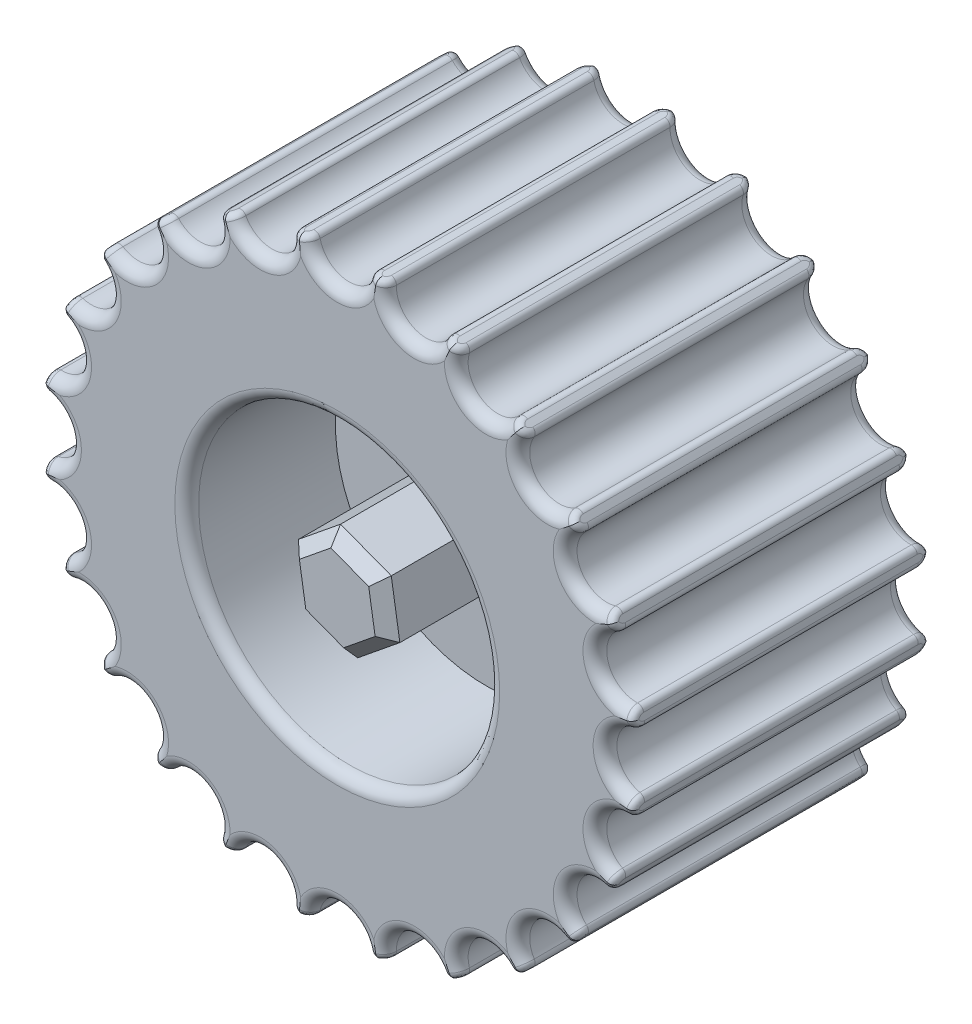
from build123d import *

# Parameters (mm, degrees)
SKETCH1_R           = 6.35
BOSS_EXTRUDE1_DEPTH = 6.35
SKETCH3_R           = 3.2131
CUT_EXTRUDE1_DEPTH  = 3.175
BOSS_EXTRUDE2_DEPTH = 3.175
SKETCH5_R           = 0.635
CUT_EXTRUDE2_DEPTH  = 11.998522628
FILLET1_R           = 0.254
CHAMFER1_SIZE       = 0.254
FILLET2_R           = 0.127


with BuildPart() as part:
    # Sketch1 → Boss-Extrude1 (new body)
    with BuildSketch(Plane.XY):
        Circle(SKETCH1_R)
    extrude(amount=BOSS_EXTRUDE1_DEPTH)

    # Sketch3 → Cut-Extrude1 (cut)
    with BuildSketch(Plane.XY.offset(6.35)):
        Circle(SKETCH3_R)
    extrude(amount=-CUT_EXTRUDE1_DEPTH, mode=Mode.SUBTRACT)

    # Sketch4 → Boss-Extrude2 (add)
    with BuildSketch(Plane.XY.offset(3.175)):
        Polygon((0.899085099, 0.730611962), (-0.18318597, 1.143936517), (-1.082271068, 0.413324555), (-0.899085099, -0.730611962), (0.18318597, -1.143936517), (1.082271068, -0.413324555), align=None)
    extrude(amount=BOSS_EXTRUDE2_DEPTH)

    # Sketch5 → Cut-Extrude2 (cut, through all)
    with BuildSketch(Plane(origin=(0, 0, 0), x_dir=(-1, 0, 0), z_dir=(0, 0, -1))):
        with Locations((0, 6.35)):
            Circle(SKETCH5_R)
        with Locations((1.643500936, 6.133628997)):
            Circle(SKETCH5_R)
        with Locations((3.175, 5.499261314)):
            Circle(SKETCH5_R)
        with Locations((4.490128061, 4.490128061)):
            Circle(SKETCH5_R)
        with Locations((5.499261314, 3.175)):
            Circle(SKETCH5_R)
        with Locations((6.133628997, 1.643500936)):
            Circle(SKETCH5_R)
        with Locations((6.35, 0)):
            Circle(SKETCH5_R)
        with Locations((6.133628997, -1.643500936)):
            Circle(SKETCH5_R)
        with Locations((5.499261314, -3.175)):
            Circle(SKETCH5_R)
        with Locations((4.490128061, -4.490128061)):
            Circle(SKETCH5_R)
        with Locations((3.175, -5.499261314)):
            Circle(SKETCH5_R)
        with Locations((1.643500936, -6.133628997)):
            Circle(SKETCH5_R)
        with Locations((0, -6.35)):
            Circle(SKETCH5_R)
        with Locations((-1.643500936, -6.133628997)):
            Circle(SKETCH5_R)
        with Locations((-3.175, -5.499261314)):
            Circle(SKETCH5_R)
        with Locations((-4.490128061, -4.490128061)):
            Circle(SKETCH5_R)
        with Locations((-5.499261314, -3.175)):
            Circle(SKETCH5_R)
        with Locations((-6.133628997, -1.643500936)):
            Circle(SKETCH5_R)
        with Locations((-6.35, 0)):
            Circle(SKETCH5_R)
        with Locations((-6.133628997, 1.643500936)):
            Circle(SKETCH5_R)
        with Locations((-5.499261314, 3.175)):
            Circle(SKETCH5_R)
        with Locations((-4.490128061, 4.490128061)):
            Circle(SKETCH5_R)
        with Locations((-3.175, 5.499261314)):
            Circle(SKETCH5_R)
        with Locations((-1.643500936, 6.133628997)):
            Circle(SKETCH5_R)
    extrude(amount=-CUT_EXTRUDE2_DEPTH, mode=Mode.SUBTRACT)

    # Fillet1
    # the kernel refuses this fillet: 0.254 mm, written as the material it takes off along each edge
    with BuildSketch(Plane(origin=(0, 0, 6.35), x_dir=(1, 0, 0), z_dir=(0, -1, 0))) as fillet1_piece_1:
        with BuildLine():
            CenterArc((3.2131 + FILLET1_R, -FILLET1_R), FILLET1_R, 90, 90)
            Line((3.2131, -FILLET1_R), (3.2131, 0))
            Line((3.2131, 0), (3.2131 + FILLET1_R, 0))
        make_face()
    revolve(axis=Axis((0, 0, 6.35), (0, 0, 1)), mode=Mode.SUBTRACT)
    with BuildSketch(Plane(origin=(3.175, 5.499261314, 6.35), x_dir=(0.9098442948493481, 0.41494982724432183, 0), z_dir=(-0.41494982724432183, 0.9098442948493481, 0))) as fillet1_piece_2:
        with BuildLine():
            CenterArc((0.635 + FILLET1_R, FILLET1_R), FILLET1_R, 180, 90)
            Line((0.635 + FILLET1_R, 0), (0.635, 0))
            Line((0.635, 0), (0.635, FILLET1_R))
        make_face()
    revolve(axis=Axis((3.175, 5.499261314, 6.35), (0, 0, -1)), revolution_arc=289.032313812, mode=Mode.SUBTRACT)
    with BuildSketch(Plane(origin=(4.490128061, 4.490128061, 6.35), x_dir=(0.9862390203495844, 0.1653257231645817, 0), z_dir=(-0.1653257231645817, 0.9862390203495844, 0))) as fillet1_piece_3:
        with BuildLine():
            CenterArc((0.635 + FILLET1_R, FILLET1_R), FILLET1_R, 180, 90)
            Line((0.635 + FILLET1_R, 0), (0.635, 0))
            Line((0.635, 0), (0.635, FILLET1_R))
        make_face()
    revolve(axis=Axis((4.490128061, 4.490128061, 6.35), (0, 0, -1)), revolution_arc=289.032313812, mode=Mode.SUBTRACT)
    with BuildSketch(Plane(origin=(5.499261314, 3.175, 6.35), x_dir=(0.9954231864500259, -0.09556505573522613, 0), z_dir=(0.09556505573522613, 0.9954231864500259, 0))) as fillet1_piece_4:
        with BuildLine():
            CenterArc((0.635 + FILLET1_R, FILLET1_R), FILLET1_R, 180, 90)
            Line((0.635 + FILLET1_R, 0), (0.635, 0))
            Line((0.635, 0), (0.635, FILLET1_R))
        make_face()
    revolve(axis=Axis((5.499261314, 3.175, 6.35), (0, 0, -1)), revolution_arc=289.032313812, mode=Mode.SUBTRACT)
    with BuildSketch(Plane(origin=(6.133628997, 1.643500936, 6.35), x_dir=(0.6362957863342693, 0.7714451842439964, 0), z_dir=(0.7714451842439964, -0.6362957863342693, 0))) as fillet1_piece_5:
        with BuildLine():
            CenterArc((0.635 + FILLET1_R, -FILLET1_R), FILLET1_R, 90, 90)
            Line((0.635, -FILLET1_R), (0.635, 0))
            Line((0.635, 0), (0.635 + FILLET1_R, 0))
        make_face()
    revolve(axis=Axis((6.133628997, 1.643500936, 6.35), (0, 0, 1)), revolution_arc=289.032313812, mode=Mode.SUBTRACT)
    with BuildSketch(Plane(origin=(6.35, 0, 6.35), x_dir=(0.8142792391139858, -0.5804733592060435, 0), z_dir=(0.5804733592060435, 0.8142792391139858, 0))) as fillet1_piece_6:
        with BuildLine():
            CenterArc((0.635 + FILLET1_R, FILLET1_R), FILLET1_R, 180, 90)
            Line((0.635 + FILLET1_R, 0), (0.635, 0))
            Line((0.635, 0), (0.635, FILLET1_R))
        make_face()
    revolve(axis=Axis((6.35, 0, 6.35), (0, 0, -1)), revolution_arc=289.032313812, mode=Mode.SUBTRACT)
    with BuildSketch(Plane(origin=(6.133628997, -1.643500936, 6.35), x_dir=(0.6362957863338796, -0.7714451842443183, 0), z_dir=(0.7714451842443183, 0.6362957863338796, 0))) as fillet1_piece_7:
        with BuildLine():
            CenterArc((0.635 + FILLET1_R, FILLET1_R), FILLET1_R, 180, 90)
            Line((0.635 + FILLET1_R, 0), (0.635, 0))
            Line((0.635, 0), (0.635, FILLET1_R))
        make_face()
    revolve(axis=Axis((6.133628997, -1.643500936, 6.35), (0, 0, -1)), revolution_arc=289.032313812, mode=Mode.SUBTRACT)
    with BuildSketch(Plane(origin=(5.499261314, -3.175, 6.35), x_dir=(0.4149498272435432, -0.9098442948497033, 0), z_dir=(0.9098442948497033, 0.4149498272435432, 0))) as fillet1_piece_8:
        with BuildLine():
            CenterArc((0.635 + FILLET1_R, FILLET1_R), FILLET1_R, 180, 90)
            Line((0.635 + FILLET1_R, 0), (0.635, 0))
            Line((0.635, 0), (0.635, FILLET1_R))
        make_face()
    revolve(axis=Axis((5.499261314, -3.175, 6.35), (0, 0, -1)), revolution_arc=289.032313812, mode=Mode.SUBTRACT)
    with BuildSketch(Plane(origin=(4.490128061, -4.490128061, 6.35), x_dir=(0.16532572316351857, -0.9862390203497627, 0), z_dir=(0.9862390203497627, 0.16532572316351857, 0))) as fillet1_piece_9:
        with BuildLine():
            CenterArc((0.635 + FILLET1_R, FILLET1_R), FILLET1_R, 180, 90)
            Line((0.635 + FILLET1_R, 0), (0.635, 0))
            Line((0.635, 0), (0.635, FILLET1_R))
        make_face()
    revolve(axis=Axis((4.490128061, -4.490128061, 6.35), (0, 0, -1)), revolution_arc=289.032313812, mode=Mode.SUBTRACT)
    with BuildSketch(Plane(origin=(3.175, -5.499261314, 6.35), x_dir=(-0.09556505573642783, -0.9954231864499106, 0), z_dir=(0.9954231864499106, -0.09556505573642783, 0))) as fillet1_piece_10:
        with BuildLine():
            CenterArc((0.635 + FILLET1_R, FILLET1_R), FILLET1_R, 180, 90)
            Line((0.635 + FILLET1_R, 0), (0.635, 0))
            Line((0.635, 0), (0.635, FILLET1_R))
        make_face()
    revolve(axis=Axis((3.175, -5.499261314, 6.35), (0, 0, -1)), revolution_arc=289.032313812, mode=Mode.SUBTRACT)
    with BuildSketch(Plane(origin=(1.643500936, -6.133628997, 6.35), x_dir=(-0.34994323401662314, -0.936770907407989, 0), z_dir=(0.936770907407989, -0.34994323401662314, 0))) as fillet1_piece_11:
        with BuildLine():
            CenterArc((0.635 + FILLET1_R, FILLET1_R), FILLET1_R, 180, 90)
            Line((0.635 + FILLET1_R, 0), (0.635, 0))
            Line((0.635, 0), (0.635, FILLET1_R))
        make_face()
    revolve(axis=Axis((1.643500936, -6.133628997, 6.35), (0, 0, -1)), revolution_arc=289.032313812, mode=Mode.SUBTRACT)
    with BuildSketch(Plane(origin=(0, -6.35, 6.35), x_dir=(-0.5804733592070518, -0.8142792391132669, 0), z_dir=(0.8142792391132669, -0.5804733592070518, 0))) as fillet1_piece_12:
        with BuildLine():
            CenterArc((0.635 + FILLET1_R, FILLET1_R), FILLET1_R, 180, 90)
            Line((0.635 + FILLET1_R, 0), (0.635, 0))
            Line((0.635, 0), (0.635, FILLET1_R))
        make_face()
    revolve(axis=Axis((0, -6.35, 6.35), (0, 0, -1)), revolution_arc=289.032313812, mode=Mode.SUBTRACT)
    with BuildSketch(Plane(origin=(-1.643500936, -6.133628997, 6.35), x_dir=(-0.7714451842450257, -0.6362957863330218, 0), z_dir=(0.6362957863330218, -0.7714451842450257, 0))) as fillet1_piece_13:
        with BuildLine():
            CenterArc((0.635 + FILLET1_R, FILLET1_R), FILLET1_R, 180, 90)
            Line((0.635 + FILLET1_R, 0), (0.635, 0))
            Line((0.635, 0), (0.635, FILLET1_R))
        make_face()
    revolve(axis=Axis((-1.643500936, -6.133628997, 6.35), (0, 0, -1)), revolution_arc=289.032313812, mode=Mode.SUBTRACT)
    with BuildSketch(Plane(origin=(-3.175, -5.499261314, 6.35), x_dir=(-0.909844294850085, -0.41494982724270635, 0), z_dir=(0.41494982724270635, -0.909844294850085, 0))) as fillet1_piece_14:
        with BuildLine():
            CenterArc((0.635 + FILLET1_R, FILLET1_R), FILLET1_R, 180, 90)
            Line((0.635 + FILLET1_R, 0), (0.635, 0))
            Line((0.635, 0), (0.635, FILLET1_R))
        make_face()
    revolve(axis=Axis((-3.175, -5.499261314, 6.35), (0, 0, -1)), revolution_arc=289.032313812, mode=Mode.SUBTRACT)
    with BuildSketch(Plane(origin=(-4.490128061, -4.490128061, 6.35), x_dir=(-0.9862390203498705, -0.16532572316287528, 0), z_dir=(0.16532572316287528, -0.9862390203498705, 0))) as fillet1_piece_15:
        with BuildLine():
            CenterArc((0.635 + FILLET1_R, FILLET1_R), FILLET1_R, 180, 90)
            Line((0.635 + FILLET1_R, 0), (0.635, 0))
            Line((0.635, 0), (0.635, FILLET1_R))
        make_face()
    revolve(axis=Axis((-4.490128061, -4.490128061, 6.35), (0, 0, -1)), revolution_arc=289.032313812, mode=Mode.SUBTRACT)
    with BuildSketch(Plane(origin=(-5.499261314, -3.175, 6.35), x_dir=(-0.9954231864498778, 0.09556505573677002, 0), z_dir=(-0.09556505573677002, -0.9954231864498778, 0))) as fillet1_piece_16:
        with BuildLine():
            CenterArc((0.635 + FILLET1_R, FILLET1_R), FILLET1_R, 180, 90)
            Line((0.635 + FILLET1_R, 0), (0.635, 0))
            Line((0.635, 0), (0.635, FILLET1_R))
        make_face()
    revolve(axis=Axis((-5.499261314, -3.175, 6.35), (0, 0, -1)), revolution_arc=289.032313812, mode=Mode.SUBTRACT)
    with BuildSketch(Plane(origin=(-6.133628997, -1.643500936, 6.35), x_dir=(-0.9367709074079861, 0.3499432340166307, 0), z_dir=(-0.3499432340166307, -0.9367709074079861, 0))) as fillet1_piece_17:
        with BuildLine():
            CenterArc((0.635 + FILLET1_R, FILLET1_R), FILLET1_R, 180, 90)
            Line((0.635 + FILLET1_R, 0), (0.635, 0))
            Line((0.635, 0), (0.635, FILLET1_R))
        make_face()
    revolve(axis=Axis((-6.133628997, -1.643500936, 6.35), (0, 0, -1)), revolution_arc=289.032313812, mode=Mode.SUBTRACT)
    with BuildSketch(Plane(origin=(-6.35, 0, 6.35), x_dir=(-0.8142792391134588, 0.5804733592067826, 0), z_dir=(-0.5804733592067826, -0.8142792391134588, 0))) as fillet1_piece_18:
        with BuildLine():
            CenterArc((0.635 + FILLET1_R, FILLET1_R), FILLET1_R, 180, 90)
            Line((0.635 + FILLET1_R, 0), (0.635, 0))
            Line((0.635, 0), (0.635, FILLET1_R))
        make_face()
    revolve(axis=Axis((-6.35, 0, 6.35), (0, 0, -1)), revolution_arc=289.032313812, mode=Mode.SUBTRACT)
    with BuildSketch(Plane(origin=(-6.133628997, 1.643500936, 6.35), x_dir=(-0.6362957863335225, 0.7714451842446127, 0), z_dir=(-0.7714451842446127, -0.6362957863335225, 0))) as fillet1_piece_19:
        with BuildLine():
            CenterArc((0.635 + FILLET1_R, FILLET1_R), FILLET1_R, 180, 90)
            Line((0.635 + FILLET1_R, 0), (0.635, 0))
            Line((0.635, 0), (0.635, FILLET1_R))
        make_face()
    revolve(axis=Axis((-6.133628997, 1.643500936, 6.35), (0, 0, -1)), revolution_arc=289.032313812, mode=Mode.SUBTRACT)
    with BuildSketch(Plane(origin=(-5.499261314, 3.175, 6.35), x_dir=(-0.4149498272435533, 0.9098442948496986, 0), z_dir=(-0.9098442948496986, -0.4149498272435533, 0))) as fillet1_piece_20:
        with BuildLine():
            CenterArc((0.635 + FILLET1_R, FILLET1_R), FILLET1_R, 180, 90)
            Line((0.635 + FILLET1_R, 0), (0.635, 0))
            Line((0.635, 0), (0.635, FILLET1_R))
        make_face()
    revolve(axis=Axis((-5.499261314, 3.175, 6.35), (0, 0, -1)), revolution_arc=289.032313812, mode=Mode.SUBTRACT)
    with BuildSketch(Plane(origin=(-4.490128061, 4.490128061, 6.35), x_dir=(-0.1653257231640058, 0.986239020349681, 0), z_dir=(-0.986239020349681, -0.1653257231640058, 0))) as fillet1_piece_21:
        with BuildLine():
            CenterArc((0.635 + FILLET1_R, FILLET1_R), FILLET1_R, 180, 90)
            Line((0.635 + FILLET1_R, 0), (0.635, 0))
            Line((0.635, 0), (0.635, FILLET1_R))
        make_face()
    revolve(axis=Axis((-4.490128061, 4.490128061, 6.35), (0, 0, -1)), revolution_arc=289.032313812, mode=Mode.SUBTRACT)
    with BuildSketch(Plane(origin=(-3.175, 5.499261314, 6.35), x_dir=(0.09556505573548738, 0.9954231864500008, 0), z_dir=(-0.9954231864500008, 0.09556505573548738, 0))) as fillet1_piece_22:
        with BuildLine():
            CenterArc((0.635 + FILLET1_R, FILLET1_R), FILLET1_R, 180, 90)
            Line((0.635 + FILLET1_R, 0), (0.635, 0))
            Line((0.635, 0), (0.635, FILLET1_R))
        make_face()
    revolve(axis=Axis((-3.175, 5.499261314, 6.35), (0, 0, -1)), revolution_arc=289.032313812, mode=Mode.SUBTRACT)
    with BuildSketch(Plane(origin=(-1.643500936, 6.133628997, 6.35), x_dir=(0.34994323401522254, 0.9367709074085122, 0), z_dir=(-0.9367709074085122, 0.34994323401522254, 0))) as fillet1_piece_23:
        with BuildLine():
            CenterArc((0.635 + FILLET1_R, FILLET1_R), FILLET1_R, 180, 90)
            Line((0.635 + FILLET1_R, 0), (0.635, 0))
            Line((0.635, 0), (0.635, FILLET1_R))
        make_face()
    revolve(axis=Axis((-1.643500936, 6.133628997, 6.35), (0, 0, -1)), revolution_arc=289.032313812, mode=Mode.SUBTRACT)
    with BuildSketch(Plane(origin=(0, 6.35, 6.35), x_dir=(0.5804733592057173, 0.8142792391142183, 0), z_dir=(-0.8142792391142183, 0.5804733592057173, 0))) as fillet1_piece_24:
        with BuildLine():
            CenterArc((0.635 + FILLET1_R, FILLET1_R), FILLET1_R, 180, 90)
            Line((0.635 + FILLET1_R, 0), (0.635, 0))
            Line((0.635, 0), (0.635, FILLET1_R))
        make_face()
    revolve(axis=Axis((0, 6.35, 6.35), (0, 0, -1)), revolution_arc=289.032313812, mode=Mode.SUBTRACT)
    with BuildSketch(Plane(origin=(1.643500936, 6.133628997, 6.35), x_dir=(0.7714451842439507, 0.636295786334325, 0), z_dir=(-0.636295786334325, 0.7714451842439507, 0))) as fillet1_piece_25:
        with BuildLine():
            CenterArc((0.635 + FILLET1_R, FILLET1_R), FILLET1_R, 180, 90)
            Line((0.635 + FILLET1_R, 0), (0.635, 0))
            Line((0.635, 0), (0.635, FILLET1_R))
        make_face()
    revolve(axis=Axis((1.643500936, 6.133628997, 6.35), (0, 0, -1)), revolution_arc=289.032313812, mode=Mode.SUBTRACT)
    with BuildSketch(Plane(origin=(0, 6.35, 0), x_dir=(0.5804733592057083, 0.8142792391142248, 0), z_dir=(-0.8142792391142248, 0.5804733592057083, 0))) as fillet1_piece_26:
        with BuildLine():
            CenterArc((0.635 + FILLET1_R, -FILLET1_R), FILLET1_R, 90, 90)
            Line((0.635 + FILLET1_R, 0), (0.635, 0))
            Line((0.635, 0), (0.635, -FILLET1_R))
        make_face()
    revolve(axis=Axis((0, 6.35, 0), (0, 0, -1)), revolution_arc=289.032313812, mode=Mode.SUBTRACT)
    with BuildSketch(Plane(origin=(-1.643500936, 6.133628997, 0), x_dir=(0.3499432340151975, 0.9367709074085214, 0), z_dir=(-0.9367709074085214, 0.3499432340151975, 0))) as fillet1_piece_27:
        with BuildLine():
            CenterArc((0.635 + FILLET1_R, -FILLET1_R), FILLET1_R, 90, 90)
            Line((0.635 + FILLET1_R, 0), (0.635, 0))
            Line((0.635, 0), (0.635, -FILLET1_R))
        make_face()
    revolve(axis=Axis((-1.643500936, 6.133628997, 0), (0, 0, -1)), revolution_arc=289.032313812, mode=Mode.SUBTRACT)
    with BuildSketch(Plane(origin=(-3.175, 5.499261314, 0), x_dir=(0.0955650557355119, 0.9954231864499986, 0), z_dir=(-0.9954231864499986, 0.0955650557355119, 0))) as fillet1_piece_28:
        with BuildLine():
            CenterArc((0.635 + FILLET1_R, -FILLET1_R), FILLET1_R, 90, 90)
            Line((0.635 + FILLET1_R, 0), (0.635, 0))
            Line((0.635, 0), (0.635, -FILLET1_R))
        make_face()
    revolve(axis=Axis((-3.175, 5.499261314, 0), (0, 0, -1)), revolution_arc=289.032313812, mode=Mode.SUBTRACT)
    with BuildSketch(Plane(origin=(-4.490128061, 4.490128061, 0), x_dir=(-0.16532572316400443, 0.9862390203496813, 0), z_dir=(-0.9862390203496813, -0.16532572316400443, 0))) as fillet1_piece_29:
        with BuildLine():
            CenterArc((0.635 + FILLET1_R, -FILLET1_R), FILLET1_R, 90, 90)
            Line((0.635 + FILLET1_R, 0), (0.635, 0))
            Line((0.635, 0), (0.635, -FILLET1_R))
        make_face()
    revolve(axis=Axis((-4.490128061, 4.490128061, 0), (0, 0, -1)), revolution_arc=289.032313812, mode=Mode.SUBTRACT)
    with BuildSketch(Plane(origin=(-5.499261314, 3.175, 0), x_dir=(-0.41494982724352936, 0.9098442948497095, 0), z_dir=(-0.9098442948497095, -0.41494982724352936, 0))) as fillet1_piece_30:
        with BuildLine():
            CenterArc((0.635 + FILLET1_R, -FILLET1_R), FILLET1_R, 90, 90)
            Line((0.635 + FILLET1_R, 0), (0.635, 0))
            Line((0.635, 0), (0.635, -FILLET1_R))
        make_face()
    revolve(axis=Axis((-5.499261314, 3.175, 0), (0, 0, -1)), revolution_arc=289.032313812, mode=Mode.SUBTRACT)
    with BuildSketch(Plane(origin=(-6.133628997, 1.643500936, 0), x_dir=(-0.6362957863335128, 0.7714451842446205, 0), z_dir=(-0.7714451842446205, -0.6362957863335128, 0))) as fillet1_piece_31:
        with BuildLine():
            CenterArc((0.635 + FILLET1_R, -FILLET1_R), FILLET1_R, 90, 90)
            Line((0.635 + FILLET1_R, 0), (0.635, 0))
            Line((0.635, 0), (0.635, -FILLET1_R))
        make_face()
    revolve(axis=Axis((-6.133628997, 1.643500936, 0), (0, 0, -1)), revolution_arc=289.032313812, mode=Mode.SUBTRACT)
    with BuildSketch(Plane(origin=(-6.35, 0, 0), x_dir=(-0.8142792391134647, 0.5804733592067743, 0), z_dir=(-0.5804733592067743, -0.8142792391134647, 0))) as fillet1_piece_32:
        with BuildLine():
            CenterArc((0.635 + FILLET1_R, -FILLET1_R), FILLET1_R, 90, 90)
            Line((0.635 + FILLET1_R, 0), (0.635, 0))
            Line((0.635, 0), (0.635, -FILLET1_R))
        make_face()
    revolve(axis=Axis((-6.35, 0, 0), (0, 0, -1)), revolution_arc=289.032313812, mode=Mode.SUBTRACT)
    with BuildSketch(Plane(origin=(-6.133628997, -1.643500936, 0), x_dir=(-0.9367709074079825, 0.34994323401664, 0), z_dir=(-0.34994323401664, -0.9367709074079825, 0))) as fillet1_piece_33:
        with BuildLine():
            CenterArc((0.635 + FILLET1_R, -FILLET1_R), FILLET1_R, 90, 90)
            Line((0.635 + FILLET1_R, 0), (0.635, 0))
            Line((0.635, 0), (0.635, -FILLET1_R))
        make_face()
    revolve(axis=Axis((-6.133628997, -1.643500936, 0), (0, 0, -1)), revolution_arc=289.032313812, mode=Mode.SUBTRACT)
    with BuildSketch(Plane(origin=(-5.499261314, -3.175, 0), x_dir=(-0.9954231864498754, 0.09556505573679523, 0), z_dir=(-0.09556505573679523, -0.9954231864498754, 0))) as fillet1_piece_34:
        with BuildLine():
            CenterArc((0.635 + FILLET1_R, -FILLET1_R), FILLET1_R, 90, 90)
            Line((0.635 + FILLET1_R, 0), (0.635, 0))
            Line((0.635, 0), (0.635, -FILLET1_R))
        make_face()
    revolve(axis=Axis((-5.499261314, -3.175, 0), (0, 0, -1)), revolution_arc=289.032313812, mode=Mode.SUBTRACT)
    with BuildSketch(Plane(origin=(-4.490128061, -4.490128061, 0), x_dir=(-0.9862390203498705, -0.16532572316287528, 0), z_dir=(0.16532572316287528, -0.9862390203498705, 0))) as fillet1_piece_35:
        with BuildLine():
            CenterArc((0.635 + FILLET1_R, -FILLET1_R), FILLET1_R, 90, 90)
            Line((0.635 + FILLET1_R, 0), (0.635, 0))
            Line((0.635, 0), (0.635, -FILLET1_R))
        make_face()
    revolve(axis=Axis((-4.490128061, -4.490128061, 0), (0, 0, -1)), revolution_arc=289.032313812, mode=Mode.SUBTRACT)
    with BuildSketch(Plane(origin=(-3.175, -5.499261314, 0), x_dir=(-0.9098442948500944, -0.4149498272426852, 0), z_dir=(0.4149498272426852, -0.9098442948500944, 0))) as fillet1_piece_36:
        with BuildLine():
            CenterArc((0.635 + FILLET1_R, -FILLET1_R), FILLET1_R, 90, 90)
            Line((0.635 + FILLET1_R, 0), (0.635, 0))
            Line((0.635, 0), (0.635, -FILLET1_R))
        make_face()
    revolve(axis=Axis((-3.175, -5.499261314, 0), (0, 0, -1)), revolution_arc=289.032313812, mode=Mode.SUBTRACT)
    with BuildSketch(Plane(origin=(-1.643500936, -6.133628997, 0), x_dir=(-0.7714451842450145, -0.6362957863330352, 0), z_dir=(0.6362957863330352, -0.7714451842450145, 0))) as fillet1_piece_37:
        with BuildLine():
            CenterArc((0.635 + FILLET1_R, -FILLET1_R), FILLET1_R, 90, 90)
            Line((0.635 + FILLET1_R, 0), (0.635, 0))
            Line((0.635, 0), (0.635, -FILLET1_R))
        make_face()
    revolve(axis=Axis((-1.643500936, -6.133628997, 0), (0, 0, -1)), revolution_arc=289.032313812, mode=Mode.SUBTRACT)
    with BuildSketch(Plane(origin=(0, -6.35, 0), x_dir=(-0.5804733592070435, -0.8142792391132728, 0), z_dir=(0.8142792391132728, -0.5804733592070435, 0))) as fillet1_piece_38:
        with BuildLine():
            CenterArc((0.635 + FILLET1_R, -FILLET1_R), FILLET1_R, 90, 90)
            Line((0.635 + FILLET1_R, 0), (0.635, 0))
            Line((0.635, 0), (0.635, -FILLET1_R))
        make_face()
    revolve(axis=Axis((0, -6.35, 0), (0, 0, -1)), revolution_arc=289.032313812, mode=Mode.SUBTRACT)
    with BuildSketch(Plane(origin=(1.643500936, -6.133628997, 0), x_dir=(0.7714451842446837, -0.6362957863334364, 0), z_dir=(-0.6362957863334364, -0.7714451842446837, 0))) as fillet1_piece_39:
        with BuildLine():
            CenterArc((0.635 + FILLET1_R, FILLET1_R), FILLET1_R, 180, 90)
            Line((0.635 + FILLET1_R, 0), (0.635, 0))
            Line((0.635, 0), (0.635, FILLET1_R))
        make_face()
    revolve(axis=Axis((1.643500936, -6.133628997, 0), (0, 0, 1)), revolution_arc=289.032313812, mode=Mode.SUBTRACT)
    with BuildSketch(Plane(origin=(3.175, -5.499261314, 0), x_dir=(0.9098442948497907, -0.4149498272433513, 0), z_dir=(-0.4149498272433513, -0.9098442948497907, 0))) as fillet1_piece_40:
        with BuildLine():
            CenterArc((0.635 + FILLET1_R, FILLET1_R), FILLET1_R, 180, 90)
            Line((0.635 + FILLET1_R, 0), (0.635, 0))
            Line((0.635, 0), (0.635, FILLET1_R))
        make_face()
    revolve(axis=Axis((3.175, -5.499261314, 0), (0, 0, 1)), revolution_arc=289.032313812, mode=Mode.SUBTRACT)
    with BuildSketch(Plane(origin=(4.490128061, -4.490128061, 0), x_dir=(0.9862390203497224, -0.16532572316375782, 0), z_dir=(-0.16532572316375782, -0.9862390203497224, 0))) as fillet1_piece_41:
        with BuildLine():
            CenterArc((0.635 + FILLET1_R, FILLET1_R), FILLET1_R, 180, 90)
            Line((0.635 + FILLET1_R, 0), (0.635, 0))
            Line((0.635, 0), (0.635, FILLET1_R))
        make_face()
    revolve(axis=Axis((4.490128061, -4.490128061, 0), (0, 0, 1)), revolution_arc=289.032313812, mode=Mode.SUBTRACT)
    with BuildSketch(Plane(origin=(5.499261314, -3.175, 0), x_dir=(0.9954231864499721, 0.09556505573578714, 0), z_dir=(0.09556505573578714, -0.9954231864499721, 0))) as fillet1_piece_42:
        with BuildLine():
            CenterArc((0.635 + FILLET1_R, FILLET1_R), FILLET1_R, 180, 90)
            Line((0.635 + FILLET1_R, 0), (0.635, 0))
            Line((0.635, 0), (0.635, FILLET1_R))
        make_face()
    revolve(axis=Axis((5.499261314, -3.175, 0), (0, 0, 1)), revolution_arc=289.032313812, mode=Mode.SUBTRACT)
    with BuildSketch(Plane(origin=(6.133628997, -1.643500936, 0), x_dir=(0.9367709074083662, 0.34994323401561306, 0), z_dir=(0.34994323401561306, -0.9367709074083662, 0))) as fillet1_piece_43:
        with BuildLine():
            CenterArc((0.635 + FILLET1_R, FILLET1_R), FILLET1_R, 180, 90)
            Line((0.635 + FILLET1_R, 0), (0.635, 0))
            Line((0.635, 0), (0.635, FILLET1_R))
        make_face()
    revolve(axis=Axis((6.133628997, -1.643500936, 0), (0, 0, 1)), revolution_arc=289.032313812, mode=Mode.SUBTRACT)
    with BuildSketch(Plane(origin=(6.35, 0, 0), x_dir=(0.8142792391140643, 0.5804733592059335, 0), z_dir=(0.5804733592059335, -0.8142792391140643, 0))) as fillet1_piece_44:
        with BuildLine():
            CenterArc((0.635 + FILLET1_R, FILLET1_R), FILLET1_R, 180, 90)
            Line((0.635 + FILLET1_R, 0), (0.635, 0))
            Line((0.635, 0), (0.635, FILLET1_R))
        make_face()
    revolve(axis=Axis((6.35, 0, 0), (0, 0, 1)), revolution_arc=289.032313812, mode=Mode.SUBTRACT)
    with BuildSketch(Plane(origin=(6.133628997, 1.643500936, 0), x_dir=(0.6362957863342817, 0.7714451842439864, 0), z_dir=(0.7714451842439864, -0.6362957863342817, 0))) as fillet1_piece_45:
        with BuildLine():
            CenterArc((0.635 + FILLET1_R, FILLET1_R), FILLET1_R, 180, 90)
            Line((0.635 + FILLET1_R, 0), (0.635, 0))
            Line((0.635, 0), (0.635, FILLET1_R))
        make_face()
    revolve(axis=Axis((6.133628997, 1.643500936, 0), (0, 0, 1)), revolution_arc=289.032313812, mode=Mode.SUBTRACT)
    with BuildSketch(Plane(origin=(5.499261314, 3.175, 0), x_dir=(0.4149498272442729, 0.9098442948493703, 0), z_dir=(0.9098442948493703, -0.4149498272442729, 0))) as fillet1_piece_46:
        with BuildLine():
            CenterArc((0.635 + FILLET1_R, FILLET1_R), FILLET1_R, 180, 90)
            Line((0.635 + FILLET1_R, 0), (0.635, 0))
            Line((0.635, 0), (0.635, FILLET1_R))
        make_face()
    revolve(axis=Axis((5.499261314, 3.175, 0), (0, 0, 1)), revolution_arc=289.032313812, mode=Mode.SUBTRACT)
    with BuildSketch(Plane(origin=(4.490128061, 4.490128061, 0), x_dir=(0.16532572316462227, 0.9862390203495777, 0), z_dir=(0.9862390203495777, -0.16532572316462227, 0))) as fillet1_piece_47:
        with BuildLine():
            CenterArc((0.635 + FILLET1_R, FILLET1_R), FILLET1_R, 180, 90)
            Line((0.635 + FILLET1_R, 0), (0.635, 0))
            Line((0.635, 0), (0.635, FILLET1_R))
        make_face()
    revolve(axis=Axis((4.490128061, 4.490128061, 0), (0, 0, 1)), revolution_arc=289.032313812, mode=Mode.SUBTRACT)
    with BuildSketch(Plane(origin=(3.175, 5.499261314, 0), x_dir=(-0.0955650557351304, 0.9954231864500351, 0), z_dir=(0.9954231864500351, 0.0955650557351304, 0))) as fillet1_piece_48:
        with BuildLine():
            CenterArc((0.635 + FILLET1_R, FILLET1_R), FILLET1_R, 180, 90)
            Line((0.635 + FILLET1_R, 0), (0.635, 0))
            Line((0.635, 0), (0.635, FILLET1_R))
        make_face()
    revolve(axis=Axis((3.175, 5.499261314, 0), (0, 0, 1)), revolution_arc=289.032313812, mode=Mode.SUBTRACT)
    with BuildSketch(Plane(origin=(1.643500936, 6.133628997, 0), x_dir=(-0.3499432340152349, 0.9367709074085075, 0), z_dir=(0.9367709074085075, 0.3499432340152349, 0))) as fillet1_piece_49:
        with BuildLine():
            CenterArc((0.635 + FILLET1_R, FILLET1_R), FILLET1_R, 180, 90)
            Line((0.635 + FILLET1_R, 0), (0.635, 0))
            Line((0.635, 0), (0.635, FILLET1_R))
        make_face()
    revolve(axis=Axis((1.643500936, 6.133628997, 0), (0, 0, 1)), revolution_arc=289.032313812, mode=Mode.SUBTRACT)

    # Chamfer1
    chamfer1_edges = [part.edges().sort_by_distance(p)[0] for p in [
        (0.990678084, 0.158643703, 6.35),
        (0.357949565, 0.937274239, 6.35),
        (-0.632728519, 0.778630536, 6.35),
        (-0.990678084, -0.158643703, 6.35),
        (-0.357949565, -0.937274239, 6.35),
        (0.632728519, -0.778630536, 6.35),
    ]]
    chamfer(chamfer1_edges, length=CHAMFER1_SIZE)

    # Fillet2
    fillet2_edges = [part.edges().sort_by_distance(p)[0] for p in [
        (-5.919140926, 2.299189121, 0.096308676),
        (-5.81123677, 2.559692778, 0.096309101),
        (-5.788867884, 2.609886706, 3.175),
        (-5.154662131, 3.708363294, 3.175),
        (-5.811236764, 2.559692793, 6.253690879),
        (-5.91914092, 2.299189136, 6.253691344),
        (-6.267105379, 1.022687715, 3.175),
        (-5.938816324, 2.247879148, 3.175),
        (-5.122377172, 3.752832533, 0.096308708),
        (-4.950726439, 3.976532113, 0.096309101),
        (-4.916128609, 4.019226231, 3.175),
        (-4.019226231, 4.916128609, 3.175),
        (-4.950726429, 3.976532126, 6.253690879),
        (-5.122377163, 3.752832546, 6.253691312),
        (-3.976531852, 4.950726649, 0.096308678),
        (-3.752832282, 5.122377357, 0.096309101),
        (-3.708363294, 5.154662131, 3.175),
        (-2.609886706, 5.788867884, 3.175),
        (-3.752832269, 5.122377366, 6.253690879),
        (-3.976531839, 4.950726659, 6.253691343),
        (-2.559692793, 5.811236764, 0.096309122),
        (-2.299188807, 5.919141048, 0.096309101),
        (-2.247879148, 5.938816324, 3.175),
        (-1.022687715, 6.267105379, 3.175),
        (-2.299188791, 5.919141054, 6.253690879),
        (-2.559692778, 5.81123677, 6.253690899),
        (-0.968414626, 6.275720917, 0.096309122),
        (-0.688859414, 6.312525059, 0.096309101),
        (-0.634205753, 6.31825, 3.175),
        (0.634205753, 6.31825, 3.175),
        (-0.688859398, 6.312525061, 6.253690879),
        (-0.96841461, 6.27572092, 6.253690899),
        (0.688859414, 6.312525059, 0.096309101),
        (0.968414626, 6.275720917, 0.096309121),
        (1.022687715, 6.267105379, 3.175),
        (2.247879148, 5.938816324, 3.175),
        (0.968414626, 6.275720917, 6.253690879),
        (0.688859414, 6.31252506, 6.253690899),
        (2.299188791, 5.919141054, 0.096309121),
        (2.559692478, 5.811236903, 0.096308688),
        (2.609886706, 5.788867884, 3.175),
        (3.708363294, 5.154662131, 3.175),
        (2.559692477, 5.811236903, 6.253691313),
        (2.299188791, 5.919141054, 6.253690879),
        (3.752832549, 5.12237716, 0.096308682),
        (3.976531849, 4.950726651, 0.096308674),
        (4.019226231, 4.916128609, 3.175),
        (4.916128609, 4.019226231, 3.175),
        (3.976531862, 4.95072664, 6.253691305),
        (3.752832563, 5.122377151, 6.253691338),
        (4.950726643, 3.976531859, 0.09630869),
        (5.122377157, 3.752832554, 0.096308675),
        (5.154662131, 3.708363294, 3.175),
        (5.788867884, 2.609886706, 3.175),
        (5.122377159, 3.752832551, 6.25369132),
        (4.950726653, 3.976531846, 6.253691331),
        (5.811236907, 2.559692468, 0.096308674),
        (5.919141048, 2.299188807, 0.096309101),
        (5.938816324, 2.247879148, 3.175),
        (6.267105379, 1.022687715, 3.175),
        (5.919141054, 2.299188791, 6.253690878),
        (5.811236913, 2.559692453, 6.253691346),
        (6.275720917, 0.968414626, 0.096309121),
        (6.31252506, 0.688859414, 0.096309101),
        (6.31825, 0.634205753, 3.175),
        (6.31825, -0.634205753, 3.175),
        (6.312525061, 0.688859398, 6.253690879),
        (6.27572092, 0.96841461, 6.253690899),
        (6.312525023, -0.688859749, 0.096308676),
        (6.27572092, -0.96841461, 0.096309101),
        (6.267105379, -1.022687715, 3.175),
        (5.938816324, -2.247879148, 3.175),
        (6.275720917, -0.968414626, 6.253690879),
        (6.312525021, -0.688859765, 6.253691344),
        (5.919141054, -2.299188791, 0.096309121),
        (5.81123677, -2.559692778, 0.096309101),
        (5.788867884, -2.609886706, 3.175),
        (5.154662131, -3.708363294, 3.175),
        (5.811236764, -2.559692793, 6.253690879),
        (5.91914091, -2.299189163, 6.253691381),
        (5.122377165, -3.752832544, 0.096308691),
        (4.950726439, -3.976532113, 0.096309101),
        (4.916128609, -4.019226231, 3.175),
        (4.019226231, -4.916128609, 3.175),
        (4.950726429, -3.976532126, 6.253690879),
        (5.122377155, -3.752832557, 6.253691329),
        (3.976532126, -4.950726429, 0.096309121),
        (3.752832282, -5.122377357, 0.096309101),
        (3.708363294, -5.154662131, 3.175),
        (2.609886706, -5.788867884, 3.175),
        (3.752832269, -5.122377366, 6.253690879),
        (3.976532113, -4.950726439, 6.253690899),
        (2.559692793, -5.811236764, 0.096309121),
        (2.299188807, -5.919141048, 0.096309101),
        (2.247879148, -5.938816324, 3.175),
        (1.022687715, -6.267105379, 3.175),
        (2.299188791, -5.919141054, 6.253690879),
        (2.559692778, -5.81123677, 6.253690899),
        (0.968414626, -6.275720917, 0.096309121),
        (0.688859414, -6.312525059, 0.096309101),
        (0.634205753, -6.31825, 3.175),
        (-0.634205753, -6.31825, 3.175),
        (0.688859398, -6.312525061, 6.253690879),
        (0.96841461, -6.27572092, 6.253690899),
        (-0.688859398, -6.312525061, 0.096309122),
        (-0.96841461, -6.27572092, 0.096309101),
        (-1.022687715, -6.267105379, 3.175),
        (-2.247879148, -5.938816324, 3.175),
        (-0.968414626, -6.275720917, 6.253690879),
        (-0.688859414, -6.31252506, 6.253690899),
        (-2.299188791, -5.919141054, 0.096309122),
        (-2.559692778, -5.81123677, 0.096309101),
        (-2.609886706, -5.788867884, 3.175),
        (-3.708363294, -5.154662131, 3.175),
        (-2.559692793, -5.811236764, 6.253690879),
        (-2.299188807, -5.919141048, 6.253690899),
        (-3.752832269, -5.122377366, 0.096309122),
        (-3.976532113, -4.950726439, 0.096309101),
        (-4.019226231, -4.916128609, 3.175),
        (-4.916128609, -4.019226231, 3.175),
        (-3.976532126, -4.950726429, 6.253690879),
        (-3.752832282, -5.122377357, 6.253690899),
        (-4.950726429, -3.976532126, 0.096309122),
        (-5.122377357, -3.752832282, 0.096309101),
        (-5.154662131, -3.708363294, 3.175),
        (-5.788867884, -2.609886706, 3.175),
        (-5.122377366, -3.752832269, 6.253690879),
        (-4.950726439, -3.976532113, 6.253690899),
        (-5.811236764, -2.559692793, 0.096309122),
        (-5.919141048, -2.299188807, 0.096309101),
        (-5.938816324, -2.247879148, 3.175),
        (-6.267105379, -1.022687715, 3.175),
        (-5.919141054, -2.299188791, 6.253690879),
        (-5.81123677, -2.559692778, 6.253690899),
        (-6.275720972, -0.968414271, 0.096308669),
        (-6.312525059, -0.688859414, 0.096309101),
        (-6.31825, -0.634205753, 3.175),
        (-6.31825, 0.634205753, 3.175),
        (-6.312525061, -0.688859398, 6.253690879),
        (-6.275720974, -0.968414255, 6.253691352),
        (-6.312525023, 0.68885975, 0.096308675),
        (-6.27572092, 0.96841461, 0.096309101),
        (-6.275720917, 0.968414626, 6.253690879),
        (-6.312525021, 0.688859766, 6.253691346),
    ]]
    fillet(fillet2_edges, radius=FILLET2_R)


solid = part.part
